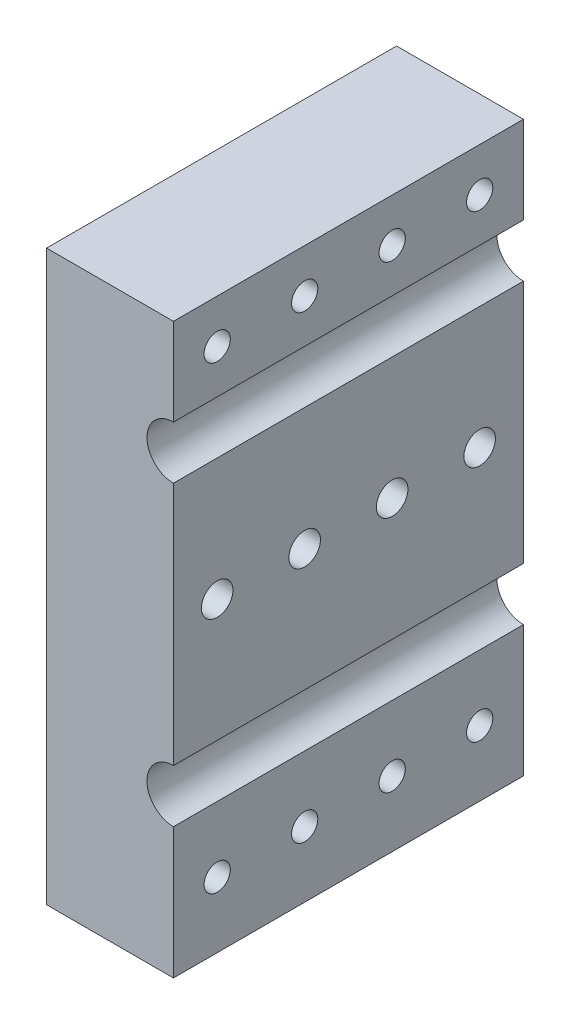
from build123d import *

# Parameters (mm, degrees)
SKETCH_1_W          = 29
SKETCH_1_H          = 65
EXTRUDE_1_DEPTH     = 40
SKETCH_2_R          = 3.025
SKETCH_2_R_2        = 3.005
CUT_EXTRUDE_3_DEPTH = 82.645575508
SKETCH_6_W          = 14.5
SKETCH_6_H          = 65
CUT_EXTRUDE_4_DEPTH = 82.645575508
SKETCH_7_R          = 1.5
CUT_EXTRUDE_5_DEPTH = 78.686871478
SKETCH_8_R          = 1.804783807
CUT_EXTRUDE_6_DEPTH = 78.686871478
SKETCH_9_R          = 1.5
CUT_EXTRUDE_7_DEPTH = 78.686871478


with BuildPart() as part:
    # 草图1 → 凸台-拉伸1 (new body)
    with BuildSketch(Plane.XY):
        with Locations((14.5, 32.5)):
            Rectangle(SKETCH_1_W, SKETCH_1_H)
    extrude(amount=EXTRUDE_1_DEPTH)

    # 草图2 → 切除-拉伸3 (cut, through all)
    # profile 1 of 2: a face of its own
    with BuildSketch(Plane.XY.offset(40)):
        with Locations((14.5, 52)):
            Circle(SKETCH_2_R)
        with Locations((14.5, 52)):
            Circle(SKETCH_2_R_2, mode=Mode.SUBTRACT)
    # profile 2 of 2: a face of its own
    with BuildSketch(Plane.XY.offset(40)):
        with Locations((14.5, 18)):
            Circle(SKETCH_2_R)
        with Locations((14.5, 18)):
            Circle(SKETCH_2_R_2, mode=Mode.SUBTRACT)
    extrude(amount=-CUT_EXTRUDE_3_DEPTH, mode=Mode.SUBTRACT)


with BuildPart() as body_2:
    # of the pieces the cut leaves, the one that is kept (cut_extrude_3_keep)
    add(part.part.solids().sort_by_distance((0, 0, 0))[0])

    # 草图6 → 切除-拉伸4 (cut, through all)
    with BuildSketch(Plane.XY.offset(40)):
        with Locations((21.75, 32.5)):
            Rectangle(SKETCH_6_W, SKETCH_6_H)
    extrude(amount=-CUT_EXTRUDE_4_DEPTH, mode=Mode.SUBTRACT)

    # 草图7 → 切除-拉伸5 (cut, through all)
    with BuildSketch(Plane(origin=(14.5, 0, 0), x_dir=(0, 0, -1), z_dir=(1, 0, 0))):
        with Locations((-35, 60.0125)):
            Circle(SKETCH_7_R)
        with Locations((-25, 60.0125)):
            Circle(SKETCH_7_R)
        with Locations((-5, 60.0125)):
            Circle(SKETCH_7_R)
        with Locations((-15, 60.0125)):
            Circle(SKETCH_7_R)
    extrude(amount=-CUT_EXTRUDE_5_DEPTH, mode=Mode.SUBTRACT)

    # 草图8 → 切除-拉伸6 (cut, through all)
    with BuildSketch(Plane(origin=(14.5, 0, 0), x_dir=(0, 0, -1), z_dir=(1, 0, 0))):
        with Locations((-35, 35)):
            Circle(SKETCH_8_R)
        with Locations((-25, 35)):
            Circle(SKETCH_8_R)
        with Locations((-15, 35)):
            Circle(SKETCH_8_R)
        with Locations((-5, 35)):
            Circle(SKETCH_8_R)
    extrude(amount=-CUT_EXTRUDE_6_DEPTH, mode=Mode.SUBTRACT)

    # 草图9 → 切除-拉伸7 (cut, through all)
    with BuildSketch(Plane(origin=(14.5, 0, 0), x_dir=(0, 0, -1), z_dir=(1, 0, 0))):
        with Locations((-35, 7.4875)):
            Circle(SKETCH_9_R)
        with Locations((-25, 7.4875)):
            Circle(SKETCH_9_R)
        with Locations((-15, 7.4875)):
            Circle(SKETCH_9_R)
        with Locations((-5, 7.4875)):
            Circle(SKETCH_9_R)
    extrude(amount=-CUT_EXTRUDE_7_DEPTH, mode=Mode.SUBTRACT)


solid = body_2.part
